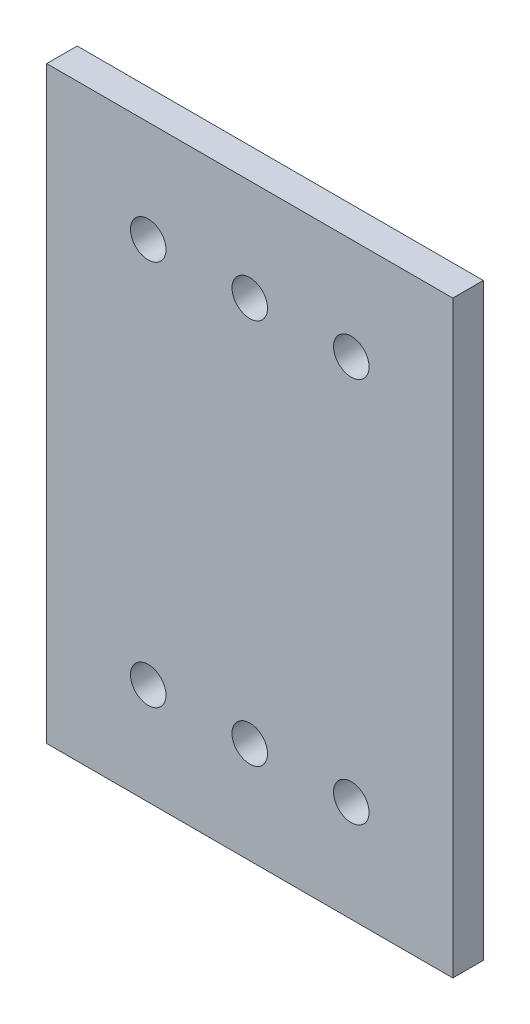
from build123d import *

# Parameters (mm, degrees)
SKETCH1_W           = 40
SKETCH1_H           = 58
SKETCH1_R           = 1.75
BOSS_EXTRUDE1_DEPTH = 3


with BuildPart() as part:
    # Sketch1 → Boss-Extrude1 (new body)
    with BuildSketch(Plane.XY):
        with Locations((20, 29)):
            Rectangle(SKETCH1_W, SKETCH1_H)
        with Locations((10, 10)):
            Circle(SKETCH1_R, mode=Mode.SUBTRACT)
        with Locations((20, 10)):
            Circle(SKETCH1_R, mode=Mode.SUBTRACT)
        with Locations((30, 10)):
            Circle(SKETCH1_R, mode=Mode.SUBTRACT)
        with Locations((10, 48)):
            Circle(SKETCH1_R, mode=Mode.SUBTRACT)
        with Locations((20, 48)):
            Circle(SKETCH1_R, mode=Mode.SUBTRACT)
        with Locations((30, 48)):
            Circle(SKETCH1_R, mode=Mode.SUBTRACT)
    extrude(amount=BOSS_EXTRUDE1_DEPTH)


solid = part.part
